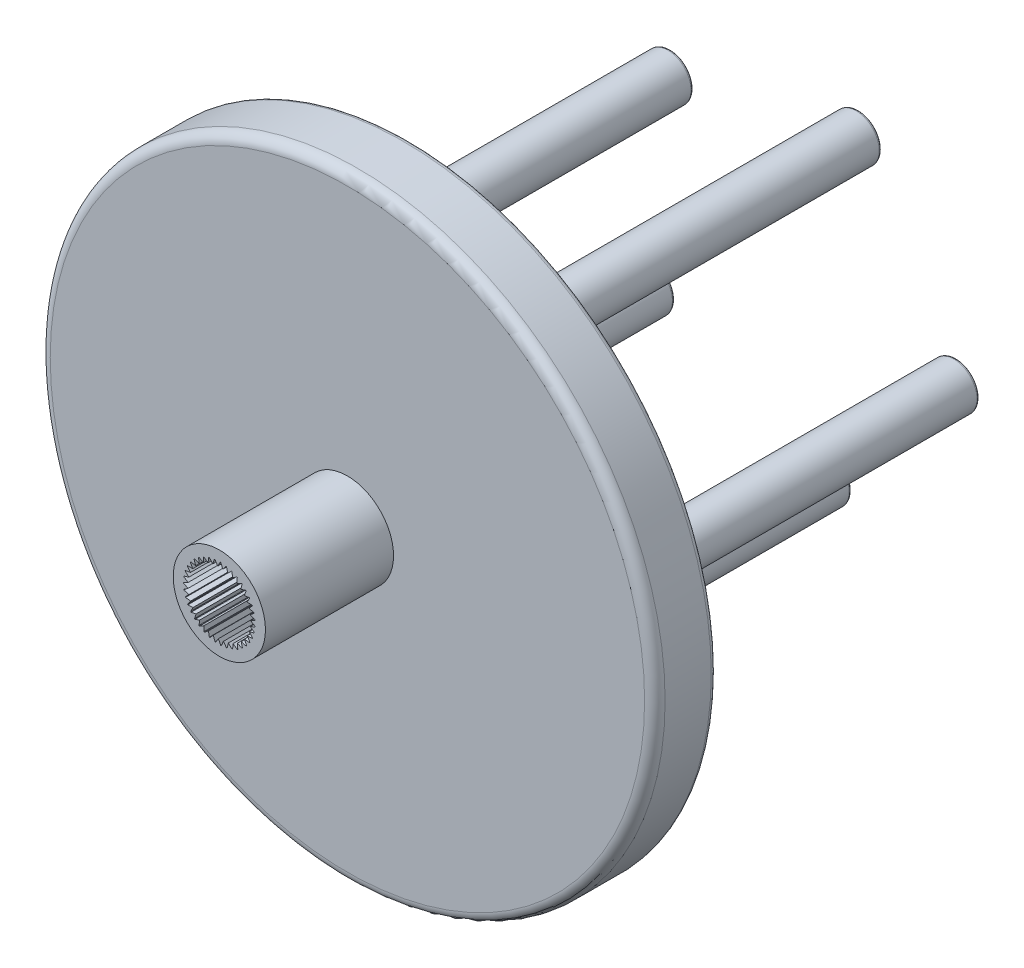
from build123d import *

# Parameters (mm, degrees)
SKETCH2_R             = 9
BOSS_EXTRUDE1_DEPTH   = 37
SKETCH2_4_R           = 4.5
BOSS_EXTRUDE2_DEPTH   = 75
BOSS_EXTRUDE2_2_DEPTH = 75
BOSS_EXTRUDE2_3_DEPTH = 75
BOSS_EXTRUDE2_4_DEPTH = 75
BOSS_EXTRUDE2_5_DEPTH = 75
SKETCH2_6_R           = 60
SKETCH2_6_R_2         = 9
BOSS_EXTRUDE3_DEPTH   = 12
CIRPATTERN1_COUNT     = 39
BOSS_EXTRUDE4_START   = -12
SKETCH3_R             = 19.5
SKETCH3_R_2           = 17.5
BOSS_EXTRUDE4_DEPTH   = 6
FILLET2_R             = 0.3
FILLET3_R             = 2
FILLET4_R             = 1
SKETCH4_R             = 3
CUT_EXTRUDE1_DEPTH    = 15
FILLET5_R             = 0.5


with BuildPart() as part:
    # Sketch2 → Boss-Extrude1 (new body)
    with BuildSketch(Plane.XY):
        Circle(SKETCH2_R)
        with BuildLine():
            Line((-6.101042139, 0.438035118), (-6.92820323, 1))
            ThreePointArc((-6.92820323, 1), (6.982027736, -0.501287038), (-7, 0))
            Line((-7, 0), (-6.101042139, 0.438035118))
        make_face(mode=Mode.SUBTRACT)
    boss_extrude1 = extrude(amount=BOSS_EXTRUDE1_DEPTH)



with BuildPart() as body_2:
    # Sketch2<4> → Boss-Extrude2 (new body)
    with BuildSketch(Plane.XY):
        with Locations((-23.954812076, 21.217138789)):
            Circle(SKETCH2_4_R)
    extrude(amount=-BOSS_EXTRUDE2_DEPTH)


with BuildPart() as body_3:
    # Sketch2<4> → Boss-Extrude2 2 (new body)
    with BuildSketch(Plane.XY):
        with Locations((12.776254073, 29.33883658)):
            Circle(SKETCH2_4_R)
    extrude(amount=-BOSS_EXTRUDE2_2_DEPTH)


with BuildPart() as body_4:
    # Sketch2<4> → Boss-Extrude2 3 (new body)
    with BuildSketch(Plane.XY):
        with Locations((31.850971343, -3.084740592)):
            Circle(SKETCH2_4_R)
    extrude(amount=-BOSS_EXTRUDE2_3_DEPTH)


with BuildPart() as body_5:
    # Sketch2<4> → Boss-Extrude2 4 (new body)
    with BuildSketch(Plane.XY):
        with Locations((6.908728791, -31.245311112)):
            Circle(SKETCH2_4_R)
    extrude(amount=-BOSS_EXTRUDE2_4_DEPTH)


with BuildPart() as body_6:
    # Sketch2<4> → Boss-Extrude2 5 (new body)
    with BuildSketch(Plane.XY):
        with Locations((-27.581142131, -16.225923664)):
            Circle(SKETCH2_4_R)
    extrude(amount=-BOSS_EXTRUDE2_5_DEPTH)


with BuildPart() as part_1:
    add(part.part)

    add(body_2.part)  # Boss-Extrude3 merges body 2

    add(body_3.part)  # Boss-Extrude3 merges body 3

    add(body_4.part)  # Boss-Extrude3 merges body 4

    add(body_5.part)  # Boss-Extrude3 merges body 5

    add(body_6.part)  # Boss-Extrude3 merges body 6
    # Sketch2<6> → Boss-Extrude3 (add)
    with BuildSketch(Plane.XY):
        Circle(SKETCH2_6_R)
        Circle(SKETCH2_6_R_2, mode=Mode.SUBTRACT)
    extrude(amount=BOSS_EXTRUDE3_DEPTH)

    # CirPattern1: Boss-Extrude1 ×39 about axis
    cirpattern1_axis = Axis((0, 0, 0), (0, 0, 1))
    for i in range(1, CIRPATTERN1_COUNT):
        add(boss_extrude1.rotate(cirpattern1_axis, i * 360 / CIRPATTERN1_COUNT))

    # Sketch3 → Boss-Extrude4 (add)
    with BuildSketch(Plane.XY.offset(12).offset(BOSS_EXTRUDE4_START)):
        Circle(SKETCH3_R)
        Circle(SKETCH3_R_2, mode=Mode.SUBTRACT)
    extrude(amount=-BOSS_EXTRUDE4_DEPTH)

    # Fillet2
    fillet2_edges = [part_1.edges().sort_by_distance(p)[0] for p in [
        (-19.5, 0, -6),
        (-17.5, 0, -6),
    ]]
    fillet(fillet2_edges, radius=FILLET2_R)

    # Fillet3
    fillet3_edges = [part_1.edges().sort_by_distance(p)[0] for p in [
        (-60, 0, 12),
    ]]
    fillet(fillet3_edges, radius=FILLET3_R)

    # Fillet4
    fillet4_edges = [part_1.edges().sort_by_distance(p)[0] for p in [
        (-60, 0, 0),
    ]]
    fillet(fillet4_edges, radius=FILLET4_R)

    # Sketch4 → Cut-Extrude1 (cut)
    with BuildSketch(Plane(origin=(0, 0, -75), x_dir=(-1, 0, 0), z_dir=(0, 0, -1))):
        with Locations((23.954812076, 21.217138789)):
            Circle(SKETCH4_R)
        with Locations((27.581142131, -16.225923664)):
            Circle(SKETCH4_R)
        with Locations((-6.908728791, -31.245311112)):
            Circle(SKETCH4_R)
        with Locations((-31.850971343, -3.084740592)):
            Circle(SKETCH4_R)
        with Locations((-12.776254073, 29.33883658)):
            Circle(SKETCH4_R)
    extrude(amount=-CUT_EXTRUDE1_DEPTH, mode=Mode.SUBTRACT)

    # Fillet5
    fillet5_edges = [part_1.edges().sort_by_distance(p)[0] for p in [
        (15.776254073, 29.33883658, -75),
        (34.850971343, -3.084740592, -75),
        (9.908728791, -31.245311112, -75),
        (-24.581142131, -16.225923664, -75),
        (-20.954812076, 21.217138789, -75),
        (-28.454812076, 21.217138789, -75),
        (8.276254073, 29.33883658, -75),
        (27.350971343, -3.084740592, -75),
        (2.408728791, -31.245311112, -75),
        (-32.081142131, -16.225923664, -75),
    ]]
    fillet(fillet5_edges, radius=FILLET5_R)


solid = part_1.part
